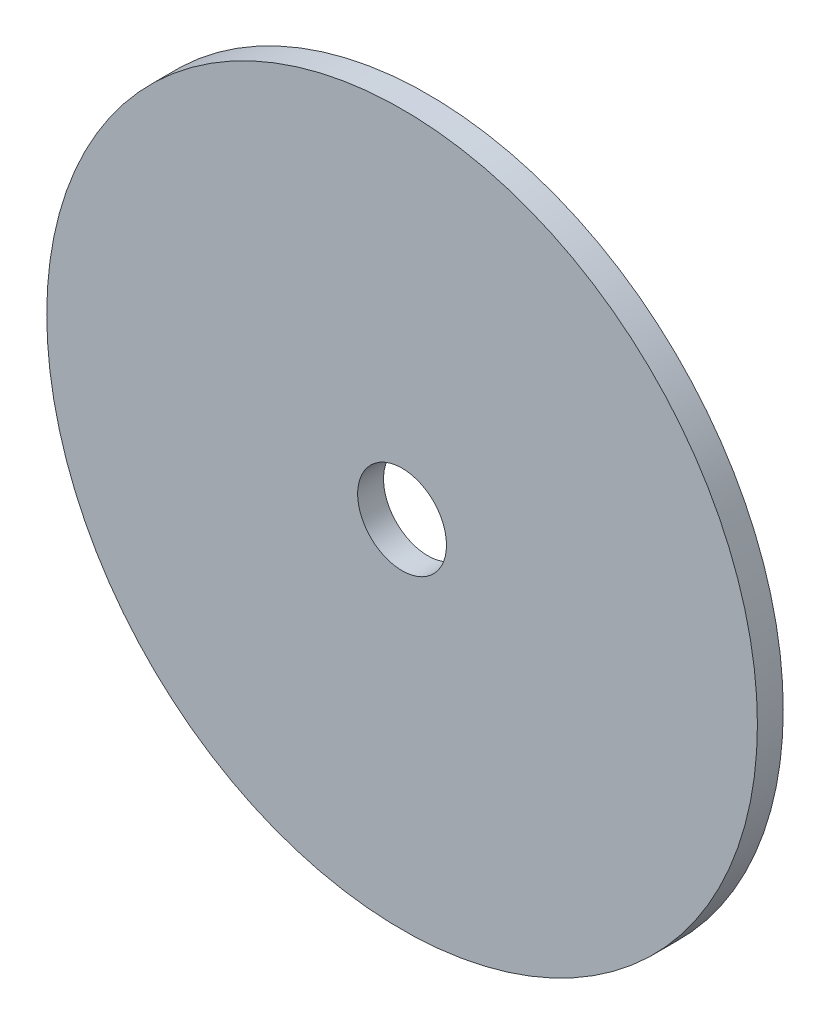
from build123d import *

# Parameters (mm, degrees)
BOSS_EXTRU_1_DEPTH      = 1.2
BOSS_EXTRU_1_DEPTH_BACK = 3.162331296
ESQUISSE1_R             = 60
ESQUISSE1_R_2           = 7.5


with BuildPart() as part:
    # Esquisse1 → Boss.-Extru.1 (new, two sides: drawn at the far end of the back side and taken through both)
    with BuildSketch(Plane.XY.offset(-BOSS_EXTRU_1_DEPTH_BACK)):
        Circle(ESQUISSE1_R)
        Circle(ESQUISSE1_R_2, mode=Mode.SUBTRACT)
    extrude(amount=BOSS_EXTRU_1_DEPTH + BOSS_EXTRU_1_DEPTH_BACK)


solid = part.part
